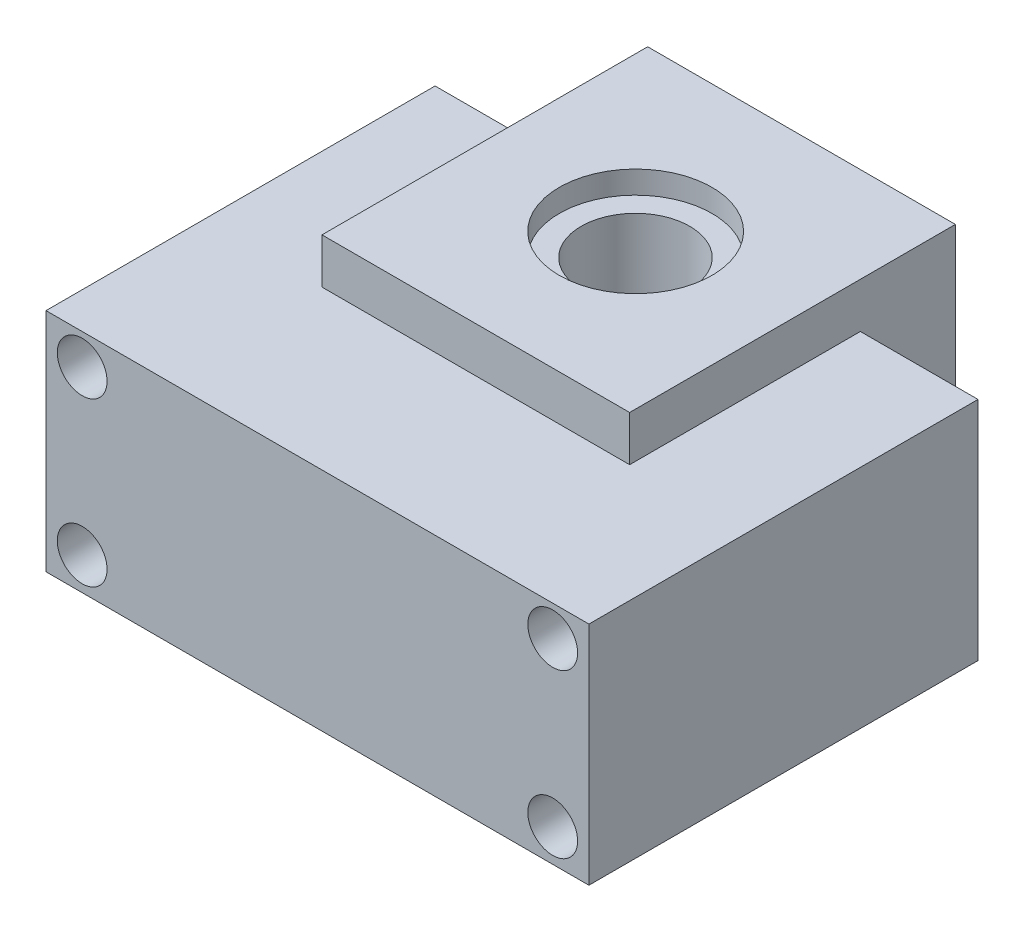
from build123d import *

# Parameters (mm, degrees)
SKETCH1_W           = 60
SKETCH1_H           = 43
BOSS_EXTRUDE1_DEPTH = 25
SKETCH2_W           = 34
SKETCH2_H           = 25.5
BOSS_EXTRUDE2_DEPTH = 5
SKETCH5_W           = 34.00729927
SKETCH5_H           = 30
BOSS_EXTRUDE3_DEPTH = 10.5
SKETCH6_R           = 6
CUT_EXTRUDE1_DEPTH  = 86.803554705
SKETCH7_R           = 8.437552617
SKETCH7_R_2         = 5.978835127
CUT_EXTRUDE2_DEPTH  = 2.5
SKETCH8_R           = 2.75
CUT_EXTRUDE3_DEPTH  = 10


with BuildPart() as part:
    # Sketch1 → Boss-Extrude1 (new body)
    with BuildSketch(Plane(origin=(0, 0, 0), x_dir=(1, 0, 0), z_dir=(0, 1, 0))):
        with Locations((30, 21.5)):
            Rectangle(SKETCH1_W, SKETCH1_H)
    extrude(amount=BOSS_EXTRUDE1_DEPTH)

    # Sketch2 → Boss-Extrude2 (add)
    with BuildSketch(Plane(origin=(0, 25, 0), x_dir=(1, 0, 0), z_dir=(0, 1, 0))):
        with Locations((30, 30.25)):
            Rectangle(SKETCH2_W, SKETCH2_H)
    extrude(amount=BOSS_EXTRUDE2_DEPTH)

    # Sketch5 → Boss-Extrude3 (add)
    with BuildSketch(Plane(origin=(0, 0, -43), x_dir=(-1, 0, 0), z_dir=(0, 0, -1))):
        with Locations((-29.996350365, 15)):
            Rectangle(SKETCH5_W, SKETCH5_H)
    extrude(amount=BOSS_EXTRUDE3_DEPTH)

    # Sketch6 → Cut-Extrude1 (cut, through all)
    with BuildSketch(Plane(origin=(0, 30, 0), x_dir=(1, 0, 0), z_dir=(0, 1, 0))):
        with Locations((29.998211201, 35.144717579)):
            Circle(SKETCH6_R)
    extrude(amount=-CUT_EXTRUDE1_DEPTH, mode=Mode.SUBTRACT)

    # Sketch7 → Cut-Extrude2 (cut, symmetric)
    with BuildSketch(Plane(origin=(0, 30, 0), x_dir=(1, 0, 0), z_dir=(0, 1, 0))):
        with Locations((29.998209055, 35.165882453)):
            Circle(SKETCH7_R)
        with Locations((29.998209055, 35.165882453)):
            Circle(SKETCH7_R_2, mode=Mode.SUBTRACT)
    extrude(amount=CUT_EXTRUDE2_DEPTH, both=True, mode=Mode.SUBTRACT)

    # Sketch8 → Cut-Extrude3 (cut)
    with BuildSketch(Plane.XY):
        with Locations((4, 21.605365098)):
            Circle(SKETCH8_R)
        with Locations((56, 21.605365098)):
            Circle(SKETCH8_R)
        with Locations((56, 3.605365098)):
            Circle(SKETCH8_R)
        with Locations((4, 3.605365098)):
            Circle(SKETCH8_R)
    extrude(amount=-CUT_EXTRUDE3_DEPTH, mode=Mode.SUBTRACT)


solid = part.part
